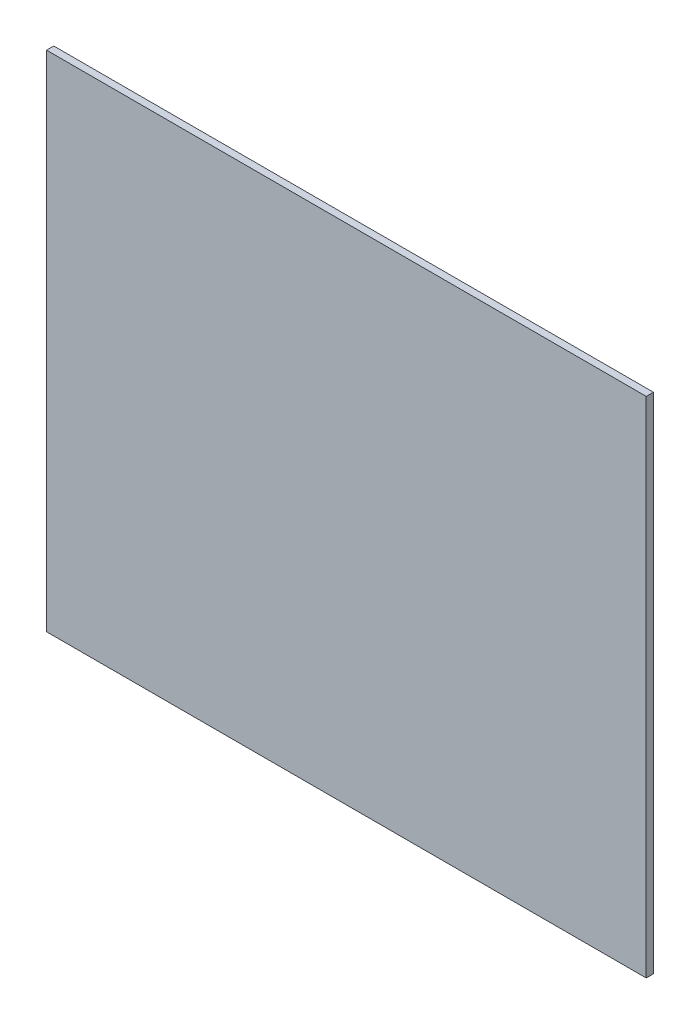
from build123d import *

# Parameters (mm, degrees)
IZIM1_W            = 1250
IZIM1_H            = 1050
TABAN_FLAN_1_DEPTH = 15


# Sheet-metal steps are written as plain solids
with BuildPart() as part:
    # Çizim1 → Taban-Flanş1 (new body)
    with BuildSketch(Plane.XY):
        with Locations((625, -525)):
            Rectangle(IZIM1_W, IZIM1_H)
    extrude(amount=-TABAN_FLAN_1_DEPTH)


solid = part.part
